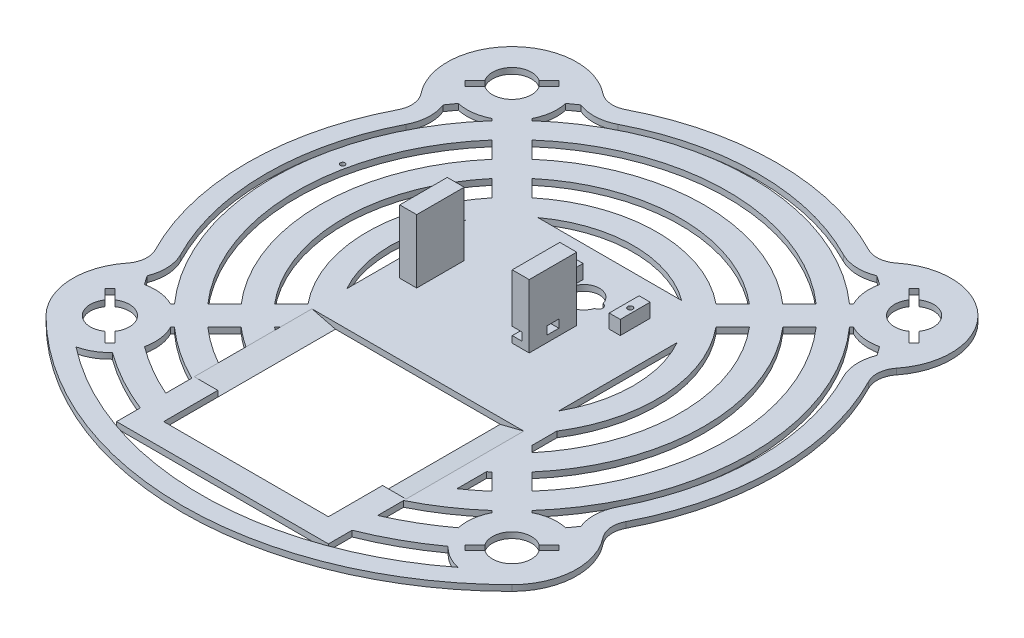
from build123d import *

# Parameters (mm, degrees)
IZIM1_R                     = 140
IZIM1_W                     = 70
IZIM1_H                     = 73
Y_KSEKLIK_EKSTR_ZYON1_DEPTH = 2.5
KES_EKSTR_ZYON1_DEPTH       = 199.005681737
IZIM3_W                     = 4.7
IZIM3_H                     = 12.7
IZIM3_R                     = 1.100088247
IZIM3_R_2                   = 1.092526642
Y_KSEKLIK_EKSTR_ZYON2_DEPTH = 5.95
IZIM4_W                     = 4
IZIM4_H                     = 30
Y_KSEKLIK_EKSTR_ZYON3_DEPTH = 4
Y_KSEKLIK_EKSTR_ZYON4_START = 4
IZIM4_3_W                   = 3
IZIM4_3_H                   = 30
IZIM4_3_W_2                 = 4
Y_KSEKLIK_EKSTR_ZYON4_DEPTH = 3
IZIM5_R                     = 3
Y_KSEKLIK_EKSTR_ZYON5_DEPTH = 2.5
Y_KSEKLIK_EKSTR_ZYON6_START = 2.5
IZIM5_3_R                   = 5
Y_KSEKLIK_EKSTR_ZYON6_DEPTH = 2
IZIM6_R                     = 8.3
KES_EKSTR_ZYON2_DEPTH       = 199.217683369
RADYUS1_R                   = 10
IZIM7_W                     = 7.2
IZIM7_H                     = 20.2
Y_KSEKLIK_EKSTR_ZYON7_DEPTH = 27
IZIM9_W                     = 4.2
IZIM9_H                     = 3.4
KES_EKSTR_ZYON3_DEPTH       = 12.6
KES_EKSTR_ZYON4_REACH       = 195.251
IZIM10_W                    = 5.073086953
IZIM10_H                    = 3.4
IZIM11_R                    = 1
KES_EKSTR_ZYON5_DEPTH       = 183.006868141
KES_EKSTR_ZYON6_DEPTH       = 183.006868141
KES_EKSTR_ZYON7_DEPTH       = 50


with BuildPart() as part:
    # Çizim1 → Yükseklik-Ekstrüzyon1 (new body)
    with BuildSketch(Plane(origin=(0, 0, 0), x_dir=(1, 0, 0), z_dir=(0, 1, 0))):
        with Locations(Location((0, 0, 0), (0, 0, 270))):
            Circle(IZIM1_R)
        with Locations((0, -76.5)):
            Rectangle(IZIM1_W, IZIM1_H, mode=Mode.SUBTRACT)
    extrude(amount=Y_KSEKLIK_EKSTR_ZYON1_DEPTH)

    # Çizim2 → Kes-Ekstrüzyon1 (cut, through all)
    # profile 1 of 2: a face of its own
    with BuildSketch(Plane.XZ):
        with BuildLine():
            ThreePointArc((14.91075, -20.232294018), (1.85, -22), (14.91075, -23.767705982))
            ThreePointArc((14.91075, -23.767705982), (16.525, -22), (14.91075, -20.232294018))
        make_face()
        with BuildLine():
            ThreePointArc((14.52075, -20.745779351), (2.35, -22), (14.52075, -23.254220649))
            ThreePointArc((14.52075, -23.254220649), (16.025, -22), (14.52075, -20.745779351))
        make_face(mode=Mode.SUBTRACT)
    # profile 2 of 2: a face of its own
    with BuildSketch(Plane.XZ):
        with BuildLine():
            ThreePointArc((14.52075, -23.254220649), (16.025, -22), (14.52075, -20.745779351))
            ThreePointArc((14.52075, -20.745779351), (2.35, -22), (14.52075, -23.254220649))
        make_face()
    extrude(amount=-KES_EKSTR_ZYON1_DEPTH, mode=Mode.SUBTRACT)

    # Çizim3 → Yükseklik-Ekstrüzyon2 (add)
    # profile 1 of 2: a face of its own
    with BuildSketch(Plane(origin=(0, 2.5, 0), x_dir=(1, 0, 0), z_dir=(0, 1, 0))):
        with Locations((-0.5, 22)):
            Rectangle(IZIM3_W, IZIM3_H)
        with Locations(Location((-0.75, 22, 0), (0, 0, 270))):
            Circle(IZIM3_R, mode=Mode.SUBTRACT)
    # profile 2 of 2: a face of its own
    with BuildSketch(Plane(origin=(0, 2.5, 0), x_dir=(1, 0, 0), z_dir=(0, 1, 0))):
        with Locations((28, 22)):
            Rectangle(IZIM3_W, IZIM3_H)
        with Locations(Location((28.25, 22, 0), (0, 0, 270))):
            Circle(IZIM3_R_2, mode=Mode.SUBTRACT)
    extrude(amount=Y_KSEKLIK_EKSTR_ZYON2_DEPTH)

    # Çizim4 → Yükseklik-Ekstrüzyon3 (add)
    with BuildSketch(Plane.XZ):
        with Locations((40, 55.105418127)):
            Rectangle(IZIM4_W, IZIM4_H)
    extrude(amount=Y_KSEKLIK_EKSTR_ZYON3_DEPTH)

    # Çizim4<3> → Yükseklik-Ekstrüzyon4 (add)
    with BuildSketch(Plane.XZ.offset(Y_KSEKLIK_EKSTR_ZYON4_START)):
        with Locations((36.5, 55.105418127)):
            Rectangle(IZIM4_3_W, IZIM4_3_H)
        with Locations((40, 55.105418127)):
            Rectangle(IZIM4_3_W_2, IZIM4_3_H)
    extrude(amount=Y_KSEKLIK_EKSTR_ZYON4_DEPTH)

    # Çizim5 → Yükseklik-Ekstrüzyon5 (add)
    with BuildSketch(Plane.XZ):
        with Locations(Location((-21.143733637, -10.434588388, 0), (0, 0, 90))):
            Circle(IZIM5_R)
    extrude(amount=Y_KSEKLIK_EKSTR_ZYON5_DEPTH)

    # Çizim5<3> → Yükseklik-Ekstrüzyon6 (add)
    with BuildSketch(Plane.XZ.offset(Y_KSEKLIK_EKSTR_ZYON6_START)):
        with Locations(Location((-21.143733637, -10.434588388, 0), (0, 0, 270))):
            Circle(IZIM5_3_R)
    extrude(amount=Y_KSEKLIK_EKSTR_ZYON6_DEPTH)

    # Çizim6 → Kes-Ekstrüzyon2 (cut, through all)
    with BuildSketch(Plane(origin=(0, 2.5, 0), x_dir=(1, 0, 0), z_dir=(0, 1, 0))):
        with BuildLine():
            ThreePointArc((112.5, 0), (108.4191081, -30.025772242), (96.472497801, -57.873199048))
            ThreePointArc((96.472497801, -57.873199048), (106.997920963, -77.865798562), (98.994949366, -98.994949366))
            ThreePointArc((98.994949366, -98.994949366), (129.343134552, -53.575680531), (140, 0))
            ThreePointArc((140, 0), (129.343134503, 53.575680649), (98.994949186, 98.994949546))
            ThreePointArc((98.994949186, 98.994949546), (106.997920971, 77.865798689), (96.472497801, 57.873199048))
            ThreePointArc((96.472497801, 57.873199048), (108.4191081, 30.025772242), (112.5, 0))
        make_face()
        with BuildLine():
            ThreePointArc((-98.994949366, 98.994949366), (-140, 0), (-98.994949366, -98.994949366))
            ThreePointArc((-98.994949366, -98.994949366), (-106.997920963, -77.865798562), (-96.472497801, -57.873199048))
            ThreePointArc((-96.472497801, -57.873199048), (-112.5, 0), (-96.472497801, 57.873199048))
            ThreePointArc((-96.472497801, 57.873199048), (-106.997920963, 77.865798562), (-98.994949366, 98.994949366))
        make_face()
        with BuildLine():
            ThreePointArc((98.994949186, 98.994949546), (-1.27e-07, 140), (-98.994949366, 98.994949366))
            ThreePointArc((-98.994949366, 98.994949366), (-77.865798562, 106.997920963), (-57.873199048, 96.472497801))
            ThreePointArc((-57.873199048, 96.472497801), (0, 112.5), (57.873199048, 96.472497801))
            ThreePointArc((57.873199048, 96.472497801), (77.865798435, 106.997920955), (98.994949186, 98.994949546))
        make_face()
        with Locations((-85.418499167, 85.418499167)):
            Circle(IZIM6_R)
        Polygon((-92.251507215, 80.706811463), (-96.494147902, 76.464170776), (-94.372827559, 74.342850433), (-90.130186871, 78.58549112), align=None)
        Polygon((-78.58549112, 90.130186871), (-74.342850433, 94.372827559), (-76.464170776, 96.494147902), (-80.706811463, 92.251507215), align=None)
        with Locations((85.418499167, 85.418499167)):
            Circle(IZIM6_R)
        Polygon((92.251507215, 80.706811463), (96.494147902, 76.464170776), (94.372827559, 74.342850433), (90.130186871, 78.58549112), align=None)
        Polygon((80.706811463, 92.251507215), (76.464170776, 96.494147902), (74.342850433, 94.372827559), (78.58549112, 90.130186871), align=None)
        with Locations((85.418499167, -85.418499167)):
            Circle(IZIM6_R)
        Polygon((92.251507215, -80.706811463), (96.494147902, -76.464170776), (94.372827559, -74.342850433), (90.130186871, -78.58549112), align=None)
        Polygon((80.706811463, -92.251507215), (76.464170776, -96.494147902), (74.342850433, -94.372827559), (78.58549112, -90.130186871), align=None)
        with Locations((-85.418499167, -85.418499167)):
            Circle(IZIM6_R)
        Polygon((-80.706811463, -92.251507215), (-76.464170776, -96.494147902), (-74.342850433, -94.372827559), (-78.58549112, -90.130186871), align=None)
        Polygon((-92.251507215, -80.706811463), (-96.494147902, -76.464170776), (-94.372827559, -74.342850433), (-90.130186871, -78.58549112), align=None)
    extrude(amount=-KES_EKSTR_ZYON2_DEPTH, mode=Mode.SUBTRACT)

    # Radyus1
    radyus1_edges = [part.edges().sort_by_distance(p)[0] for p in [
        (96.472497801, 1.25, 57.873199048),
        (96.472497801, 1.25, -57.873199048),
        (-96.472497801, 1.25, -57.873199048),
        (-96.472497801, 1.25, 57.873199048),
        (57.873199048, 1.25, -96.472497801),
        (-57.873199048, 1.25, -96.472497801),
    ]]
    fillet(radyus1_edges, radius=RADYUS1_R)

    # Çizim7 → Yükseklik-Ekstrüzyon7 (add)
    with BuildSketch(Plane(origin=(0, 2.5, 0), x_dir=(1, 0, 0), z_dir=(0, 1, 0))):
        with Locations((-33.994140019, 0)):
            Rectangle(IZIM7_W, IZIM7_H)
        with Locations((13.805859981, 0)):
            Rectangle(IZIM7_W, IZIM7_H)
    extrude(amount=Y_KSEKLIK_EKSTR_ZYON7_DEPTH)

    # Çizim9 → Kes-Ekstrüzyon3 (cut)
    with BuildSketch(Plane.XY.offset(10.1)):
        with Locations((12.305859981, 7)):
            Rectangle(IZIM9_W, IZIM9_H)
    extrude(amount=-KES_EKSTR_ZYON3_DEPTH, mode=Mode.SUBTRACT)

    # Çizim10 → Kes-Ekstrüzyon4 (cut, up to next)
    with BuildSketch(Plane(origin=(17.405859981, 0, 0), x_dir=(0, 0, -1), z_dir=(1, 0, 0)), mode=Mode.PRIVATE) as kes_ekstr_zyon4_sk1:
        with Locations((-0.036543477, 7)):
            Rectangle(IZIM10_W, IZIM10_H)
    kes_ekstr_zyon4_tool1 = extrude(kes_ekstr_zyon4_sk1.sketch, amount=-KES_EKSTR_ZYON4_REACH, mode=Mode.PRIVATE) & part.part
    add(kes_ekstr_zyon4_tool1.solids().sort_by_distance((17.40586, 7, 0.036543))[0], mode=Mode.SUBTRACT)

    # Çizim11 → Kes-Ekstrüzyon5 (cut, through all)
    with BuildSketch(Plane.XZ):
        with Locations(Location((-91.727227193, -19.757229518, 0), (0, 0, 270))):
            Circle(IZIM11_R)
    extrude(amount=-KES_EKSTR_ZYON5_DEPTH, mode=Mode.SUBTRACT)

    # Çizim12 → Kes-Ekstrüzyon6 (cut, through all)
    with BuildSketch(Plane.XZ):
        with BuildLine():
            Line((-45, 91.064139208), (-45, 102.098956051))
            ThreePointArc((-45, 102.098956051), (-56.181888533, 96.399129808), (-66.652894258, 89.479542432))
            ThreePointArc((-66.652894258, 89.479542432), (-66.373679736, 82.98234383), (-68.279347324, 76.764628698))
            Line((-68.279347324, 76.764628698), (-67.457001744, 75.942283119))
            ThreePointArc((-67.457001744, 75.942283119), (-56.734574496, 84.254765482), (-45, 91.064139208))
        make_face()
        with BuildLine():
            ThreePointArc((66.652894258, 89.479542432), (56.181888533, 96.399129808), (45, 102.098956051))
            Line((45, 102.098956051), (45, 91.064139208))
            ThreePointArc((45, 91.064139208), (56.734574496, 84.254765482), (67.457001744, 75.942283119))
            Line((67.457001744, 75.942283119), (68.279347324, 76.764628698))
            ThreePointArc((68.279347324, 76.764628698), (66.373679736, 82.98234383), (66.652894258, 89.479542432))
        make_face()
        with BuildLine():
            ThreePointArc((-71.323870204, 98.456192), (-58.611130416, 106.515029904), (-45, 112.941206847))
            Line((-45, 112.941206847), (-45, 123))
            Line((-45, 123), (45, 123))
            Line((45, 123), (45, 112.941206847))
            ThreePointArc((45, 112.941206847), (58.611130416, 106.515029904), (71.323870204, 98.456192))
            ThreePointArc((71.323870204, 98.456192), (75.794683811, 102.032414358), (81.121196742, 104.131414276))
            ThreePointArc((81.121196742, 104.131414276), (0, 132), (-81.121196742, 104.131414276))
            ThreePointArc((-81.121196742, 104.131414276), (-75.794683811, 102.032414359), (-71.323870204, 98.456192))
        make_face()
        with BuildLine():
            Line((-45, 68.041448362), (-45, 79.756868497))
            ThreePointArc((-45, 79.756868497), (-52.967204991, 74.703636243), (-60.372210827, 68.857492201))
            Line((-60.372210827, 68.857492201), (-53.284043101, 61.769324475))
            ThreePointArc((-53.284043101, 61.769324475), (-49.241985811, 65.037416375), (-45, 68.041448362))
        make_face()
        with BuildLine():
            ThreePointArc((60.372210827, 68.857492201), (56.280676207, 72.240179666), (52, 75.38009069))
            Line((52, 75.38009069), (52, 62.854106431))
            ThreePointArc((52, 62.854106431), (52.644815708, 62.315022863), (53.284043101, 61.769324475))
            Line((53.284043101, 61.769324475), (60.372210827, 68.857492201))
        make_face()
        with BuildLine():
            ThreePointArc((-75.942283119, -67.457001744), (-101.575968859, 0), (-75.942283119, 67.457001744))
            Line((-75.942283119, 67.457001744), (-76.764628698, 68.279347324))
            ThreePointArc((-76.764628698, 68.279347324), (-82.98234383, 66.373679736), (-89.479542432, 66.652894258))
            ThreePointArc((-89.479542432, 66.652894258), (-90.84268548, 64.782739379), (-92.166748051, 62.884714998))
            ThreePointArc((-92.166748051, 62.884714998), (-90.885308792, 55.322017308), (-92.868973749, 47.912458869))
            ThreePointArc((-92.868973749, 47.912458869), (-104.5, 0), (-92.868973749, -47.912458869))
            ThreePointArc((-92.868973749, -47.912458869), (-90.885308792, -55.322017308), (-92.166748051, -62.884714998))
            ThreePointArc((-92.166748051, -62.884714998), (-90.84268548, -64.782739379), (-89.479542432, -66.652894258))
            ThreePointArc((-89.479542432, -66.652894258), (-82.98234383, -66.373679736), (-76.764628698, -68.279347324))
            Line((-76.764628698, -68.279347324), (-75.942283119, -67.457001744))
        make_face()
        with BuildLine():
            Line((76.764628698, 68.279347324), (75.942283119, 67.457001744))
            ThreePointArc((75.942283119, 67.457001744), (101.575968859, 0), (75.942283119, -67.457001744))
            Line((75.942283119, -67.457001744), (76.764628698, -68.279347324))
            ThreePointArc((76.764628698, -68.279347324), (82.98234383, -66.373679736), (89.479542432, -66.652894258))
            ThreePointArc((89.479542432, -66.652894258), (90.84268548, -64.782739379), (92.166748051, -62.884714998))
            ThreePointArc((92.166748051, -62.884714998), (90.885308792, -55.322017308), (92.868973749, -47.912458869))
            ThreePointArc((92.868973749, -47.912458869), (104.5, 0), (92.868973749, 47.912458869))
            ThreePointArc((92.868973749, 47.912458869), (90.885308792, 55.322017308), (92.166748051, 62.884714998))
            ThreePointArc((92.166748051, 62.884714998), (90.84268548, 64.782739379), (89.479542432, 66.652894258))
            ThreePointArc((89.479542432, 66.652894258), (82.98234383, 66.373679736), (76.764628698, 68.279347324))
        make_face()
        with BuildLine():
            Line((-45, 53.485281374), (-45, 55.660752044))
            ThreePointArc((-45, 55.660752044), (-45.598193935, 55.171768396), (-46.191074812, 54.676356186))
            Line((-46.191074812, 54.676356186), (-45, 53.485281374))
        make_face()
        with BuildLine():
            Line((-61.769324475, 53.284043101), (-68.857492201, 60.372210827))
            ThreePointArc((-68.857492201, 60.372210827), (-91.575968859, 0), (-68.857492201, -60.372210827))
            Line((-68.857492201, -60.372210827), (-61.769324475, -53.284043101))
            ThreePointArc((-61.769324475, -53.284043101), (-81.575968859, 0), (-61.769324475, 53.284043101))
        make_face()
        with BuildLine():
            ThreePointArc((68.857492201, -60.372210827), (91.575968859, 0), (68.857492201, 60.372210827))
            Line((68.857492201, 60.372210827), (61.769324475, 53.284043101))
            ThreePointArc((61.769324475, 53.284043101), (81.575968859, 0), (61.769324475, -53.284043101))
            Line((61.769324475, -53.284043101), (68.857492201, -60.372210827))
        make_face()
        with BuildLine():
            ThreePointArc((67.457001744, -75.942283119), (0, -101.575968859), (-67.457001744, -75.942283119))
            Line((-67.457001744, -75.942283119), (-68.279347324, -76.764628698))
            ThreePointArc((-68.279347324, -76.764628698), (-66.373679736, -82.98234383), (-66.652894258, -89.479542432))
            ThreePointArc((-66.652894258, -89.479542432), (-64.782739379, -90.84268548), (-62.884714998, -92.166748051))
            ThreePointArc((-62.884714998, -92.166748051), (-55.322017308, -90.885308792), (-47.912458869, -92.868973749))
            ThreePointArc((-47.912458869, -92.868973749), (0, -104.5), (47.912458869, -92.868973749))
            ThreePointArc((47.912458869, -92.868973749), (55.322017308, -90.885308792), (62.884714998, -92.166748051))
            ThreePointArc((62.884714998, -92.166748051), (64.782739379, -90.84268548), (66.652894258, -89.479542432))
            ThreePointArc((66.652894258, -89.479542432), (66.373679736, -82.98234383), (68.279347324, -76.764628698))
            Line((68.279347324, -76.764628698), (67.457001744, -75.942283119))
        make_face()
        with BuildLine():
            Line((-47.576230089, 39.090948715), (-54.676356186, 46.191074812))
            ThreePointArc((-54.676356186, 46.191074812), (-71.575968859, 0), (-54.676356186, -46.191074812))
            Line((-54.676356186, -46.191074812), (-47.576230089, -39.090948715))
            ThreePointArc((-47.576230089, -39.090948715), (-61.575968859, 0), (-47.576230089, 39.090948715))
        make_face()
        with BuildLine():
            Line((-53.284043101, -61.769324475), (-60.372210827, -68.857492201))
            ThreePointArc((-60.372210827, -68.857492201), (0, -91.575968859), (60.372210827, -68.857492201))
            Line((60.372210827, -68.857492201), (53.284043101, -61.769324475))
            ThreePointArc((53.284043101, -61.769324475), (0, -81.575968859), (-53.284043101, -61.769324475))
        make_face()
        with BuildLine():
            Line((54.676356186, 46.191074812), (52, 43.514718626))
            Line((52, 43.514718626), (52, 32.978780161))
            ThreePointArc((52, 32.978780161), (61.460294945, -3.772543726), (47.576230089, -39.090948715))
            Line((47.576230089, -39.090948715), (54.676356186, -46.191074812))
            ThreePointArc((54.676356186, -46.191074812), (71.575968859, 0), (54.676356186, 46.191074812))
        make_face()
        with BuildLine():
            Line((-39.090948715, -47.576230089), (-46.191074812, -54.676356186))
            ThreePointArc((-46.191074812, -54.676356186), (0, -71.575968859), (46.191074812, -54.676356186))
            Line((46.191074812, -54.676356186), (39.090948715, -47.576230089))
            ThreePointArc((39.090948715, -47.576230089), (0, -61.575968859), (-39.090948715, -47.576230089))
        make_face()
        with BuildLine():
            Line((-45, -25.200804823), (-45, 25.200804823))
            ThreePointArc((-45, 25.200804823), (-51.575968859, 0), (-45, -25.200804823))
        make_face()
        with BuildLine():
            ThreePointArc((45, -25.200804823), (51.575968859, 0), (45, 25.200804823))
            Line((45, 25.200804823), (45, -25.200804823))
        make_face()
        with BuildLine():
            Line((30.520802368, -41.575968859), (-30.520802368, -41.575968859))
            ThreePointArc((-30.520802368, -41.575968859), (0, -51.575968859), (30.520802368, -41.575968859))
        make_face()
    extrude(amount=-KES_EKSTR_ZYON6_DEPTH, mode=Mode.SUBTRACT)

    # Çizim13 → Kes-Ekstrüzyon7 (cut)
    with BuildSketch(Plane.XY.offset(40)):
        Polygon((-35, 0), (-35, 2.5), (-45, 2.5), align=None)
        Polygon((35, 0), (35, 2.5), (45, 2.5), align=None)
    extrude(amount=KES_EKSTR_ZYON7_DEPTH, mode=Mode.SUBTRACT)


solid = part.part
